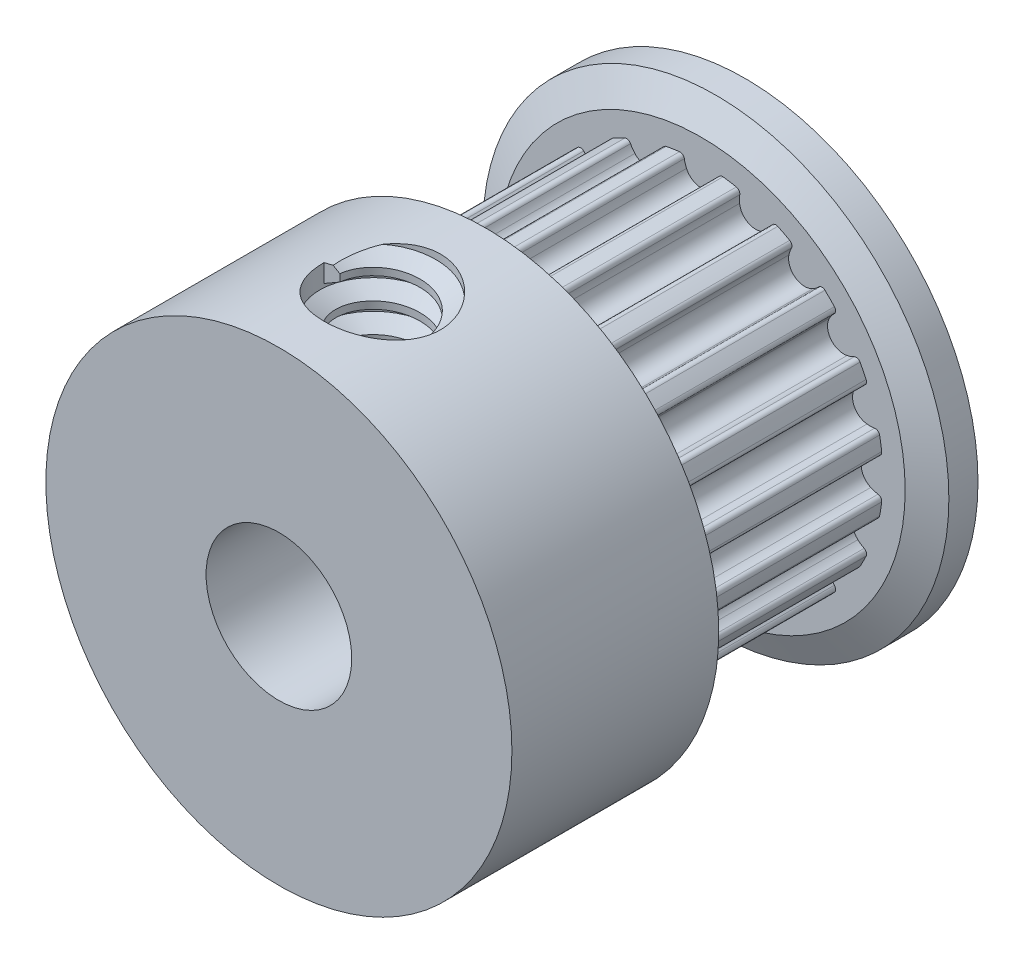
from build123d import *
from build123d.topology import SkipClean

# Parameters (mm, degrees)
SKETCH1_R               = 6.366
BASE_DEPTH              = 7.4
TOOTHCUT_DEPTH          = 12.653836793
TEETHCUTS_COUNT         = 20
SKETCH3_W               = 8
SKETCH3_H               = 7.1
SHAFTHOLE_DEPTH         = 19.391574158
SHAFTHOLE_DEPTH_BACK    = 19.391574158
SKETCH4_R               = 2.5
SKETCH5_R               = 2
FIXINGHOLE_DEPTH        = 19.391574158
CROQUIS1_W              = 7.35040616
CROQUIS1_H              = 5.249632844
CROQUIS1_R              = 2
SALIENTE_EXTRUIR1_DEPTH = 8
CROQUIS15_R             = 2.5
CROQUIS15_R_2           = 1.65
SALIENTE_EXTRUIR2_DEPTH = 16
CORTAR_EXTRUIR2_START   = -8
CROQUIS17_R             = 2
CORTAR_EXTRUIR2_DEPTH   = 8
ROSCA2_PITCH            = 1
CROQUIS20_R             = 1.65
CORTAR_EXTRUIR3_DEPTH   = 8
CROQUIS21_OUTSIDE_W     = 23.542
CROQUIS21_OUTSIDE_H     = 23.542
CROQUIS21_OUTSIDE_R     = 8
CORTAR_EXTRUIR4_DEPTH   = 8
SKETCH6_R               = 2.5
CUT_EXTRUDE1_DEPTH      = 20.595918108


with BuildPart() as part:
    # Sketch1 → Base (new body)
    with BuildSketch(Plane.XY):
        Circle(SKETCH1_R)
    extrude(amount=BASE_DEPTH)

    # Sketch2 → ToothCut (cut, through all)
    with BuildSketch(Plane.XY.offset(7.4)):
        with BuildLine():
            Line((-0.975994627, 6.162187557), (-0.995861804, 6.287623976))
            ThreePointArc((-0.995861804, 6.287623976), (0, 6.366), (0.995861804, 6.287623976))
            Line((0.995861804, 6.287623976), (0.975994627, 6.162187557))
            ThreePointArc((0.975994627, 6.162187557), (0.861900832, 6.179178583), (0.747512406, 6.19405733))
            ThreePointArc((0.747512406, 6.19405733), (0.639182458, 6.164868505), (0.581402261, 6.068697753))
            ThreePointArc((0.581402261, 6.068697753), (0.552274653, 5.940538449), (0.506591342, 5.817305906))
            ThreePointArc((0.506591342, 5.817305906), (0, 5.489), (-0.506591342, 5.817305906))
            ThreePointArc((-0.506591342, 5.817305906), (-0.552274653, 5.940538449), (-0.581402261, 6.068697753))
            ThreePointArc((-0.581402261, 6.068697753), (-0.639182458, 6.164868505), (-0.747512406, 6.19405733))
            ThreePointArc((-0.747512406, 6.19405733), (-0.861900832, 6.179178583), (-0.975994627, 6.162187557))
        make_face()
    toothcut = extrude(amount=-TOOTHCUT_DEPTH, mode=Mode.SUBTRACT)

    # TeethCuts: ToothCut ×20 about axis
    teethcuts_axis = Axis((0, 0, 0), (0, 0, 1))
    for i in range(1, TEETHCUTS_COUNT):
        add(toothcut.rotate(teethcuts_axis, i * 360 / TEETHCUTS_COUNT), mode=Mode.SUBTRACT)

    # Sketch3 → Body (revolve)
    with BuildSketch(Plane(origin=(0, 0, 0), x_dir=(1, 0, 0), z_dir=(0, 1, 0)), mode=Mode.PRIVATE) as body_sk:
        Polygon((0, 0), (0, 1.5), (-8, 1.5), (-8, 0.5), (-7, 0), align=None)
        with Locations((-4, -10.95)):
            Rectangle(SKETCH3_W, SKETCH3_H)
    revolve(body_sk.sketch.rotate(Axis((0, 0, 14.5), (0, 0, -1)), 180), axis=Axis((0, 0, 14.5), (0, 0, -1)))

    # Sketch4 → ShaftHole (cut, two sides: drawn at the far end of the back side and taken through both)
    with BuildSketch(Plane.XY.offset(-SHAFTHOLE_DEPTH_BACK)):
        with Locations(Location((0, 0, 0), (0, 0, 180))):
            Circle(SKETCH4_R)
    extrude(amount=SHAFTHOLE_DEPTH + SHAFTHOLE_DEPTH_BACK, mode=Mode.SUBTRACT)

    # Sketch5 → FixingHole (cut, through all)
    with BuildSketch(Plane(origin=(0, 0, 0), x_dir=(1, 0, 0), z_dir=(0, 1, 0))):
        with Locations(Location((0, -10.95, 0), (0, 0, 90))):
            Circle(SKETCH5_R)
    extrude(amount=FIXINGHOLE_DEPTH, mode=Mode.SUBTRACT)

    # Croquis1 → Saliente-Extruir1 (add)
    with BuildSketch(Plane(origin=(0, 0, 0), x_dir=(1, 0, 0), z_dir=(0, 1, 0))):
        with Locations((0, -10.95)):
            Rectangle(CROQUIS1_W, CROQUIS1_H)
        with Locations(Location((0, -10.95, 0), (0, 0, 270))):
            Circle(CROQUIS1_R, mode=Mode.SUBTRACT)
    extrude(amount=SALIENTE_EXTRUIR1_DEPTH)

    # Croquis15 → Saliente-Extruir2 (add)
    with BuildSketch(Plane.XY.offset(14.5)):
        Circle(CROQUIS15_R)
        Circle(CROQUIS15_R_2, mode=Mode.SUBTRACT)
    extrude(amount=-SALIENTE_EXTRUIR2_DEPTH)

    # Croquis17 → Cortar-Extruir2 (cut)
    with SkipClean():  # the faces are left unmerged after this step: merging them gives an invalid solid
        with BuildSketch(Plane(origin=(0, 8, 0), x_dir=(1, 0, 0), z_dir=(0, 1, 0)).offset(CORTAR_EXTRUIR2_START)):
            with Locations(Location((0, -10.95, 0), (0, 0, 145.58849133))):
                Circle(CROQUIS17_R)
        extrude(amount=CORTAR_EXTRUIR2_DEPTH, mode=Mode.SUBTRACT)

    # Rosca2: the profile of Perfil de rosca2 profile screwed along a right-hand helix of 6 turns, 8 arcs to a turn; built about Z, then put on its axis
    with SkipClean():  # the faces are left unmerged after this step: merging them gives an invalid solid
        rosca2_z = Axis((0, 0, 0), (0, 0, 1))
        rosca2_corners = [(2.0003, 0, -0.000173205), (2.0003, 0, 0.875173202), (1.458734125, 0, 0.562499999), (1.458734125, 0, 0.312499999)]
        with BuildLine(mode=Mode.PRIVATE) as rosca2_profile:
            Line(rosca2_corners[0], rosca2_corners[1])
            Line(rosca2_corners[1], rosca2_corners[2])
            Line(rosca2_corners[2], rosca2_corners[3])
            Line(rosca2_corners[3], rosca2_corners[0])
        rosca2_cap = Face(rosca2_profile.wire())
        rosca2_turn_angles = [0, 22.5, 45, 67.5, 90, 112.5, 135, 157.5, 180, 202.5, 225, 247.5, 270, 292.5, 315, 337.5, 360]
        rosca2_turn_weights = [1, 0.9238795325112867, 1, 0.9238795325112867, 1, 0.9238795325112867, 1, 0.9238795325112867, 1, 0.9238795325112867, 1, 0.9238795325112867, 1, 0.9238795325112867, 1, 0.9238795325112867, 1]
        rosca2_turn_rails = [Edge.make_bspline([Vector(p[0], p[1], 0).rotate(rosca2_z, rosca2_turn_angles[k]) / rosca2_turn_weights[k] + Vector(0, 0, p[2] + ROSCA2_PITCH * rosca2_turn_angles[k] / 360) for k in range(17)], [0, 0, 0, 1, 1, 2, 2, 3, 3, 4, 4, 5, 5, 6, 6, 7, 7, 8, 8, 8], 2, rosca2_turn_weights) for p in rosca2_corners]
        rosca2_turn_sides = [Face.make_surface_from_curves(rosca2_turn_rails[p[0]], rosca2_turn_rails[p[1]]) for p in [(0, 1), (1, 2), (2, 3), (3, 0)]]
        rosca2 = Plane(origin=(0, 8, 10.95), x_dir=(-1, 0, 0), z_dir=(0, -1, 0)) * Solid(Shell([*[p.moved(Location((0, 0, ROSCA2_PITCH * i))) for i in range(6) for p in rosca2_turn_sides], rosca2_cap, rosca2_cap.rotate(rosca2_z, 2160).moved(Location((0, 0, ROSCA2_PITCH * 2160 / 360)))]))
        add(rosca2)

    # Croquis20 → Cortar-Extruir3 (cut)
    with SkipClean():  # the faces are left unmerged after this step: merging them gives an invalid solid
        with BuildSketch(Plane.XY.offset(14.5)):
            Circle(CROQUIS20_R)
        extrude(amount=-CORTAR_EXTRUIR3_DEPTH, mode=Mode.SUBTRACT)

    # Croquis21 outside → Cortar-Extruir4 (cut)
    with BuildSketch(Plane.XY.offset(14.5)):
        Rectangle(CROQUIS21_OUTSIDE_W, CROQUIS21_OUTSIDE_H)
        Circle(CROQUIS21_OUTSIDE_R, mode=Mode.SUBTRACT)
    extrude(amount=-CORTAR_EXTRUIR4_DEPTH, mode=Mode.SUBTRACT)

    # Sketch6 → Cut-Extrude1 (cut, through all)
    with BuildSketch(Plane.XY.offset(14.5)):
        Circle(SKETCH6_R)
    extrude(amount=-CUT_EXTRUDE1_DEPTH, mode=Mode.SUBTRACT)


solid = part.part
